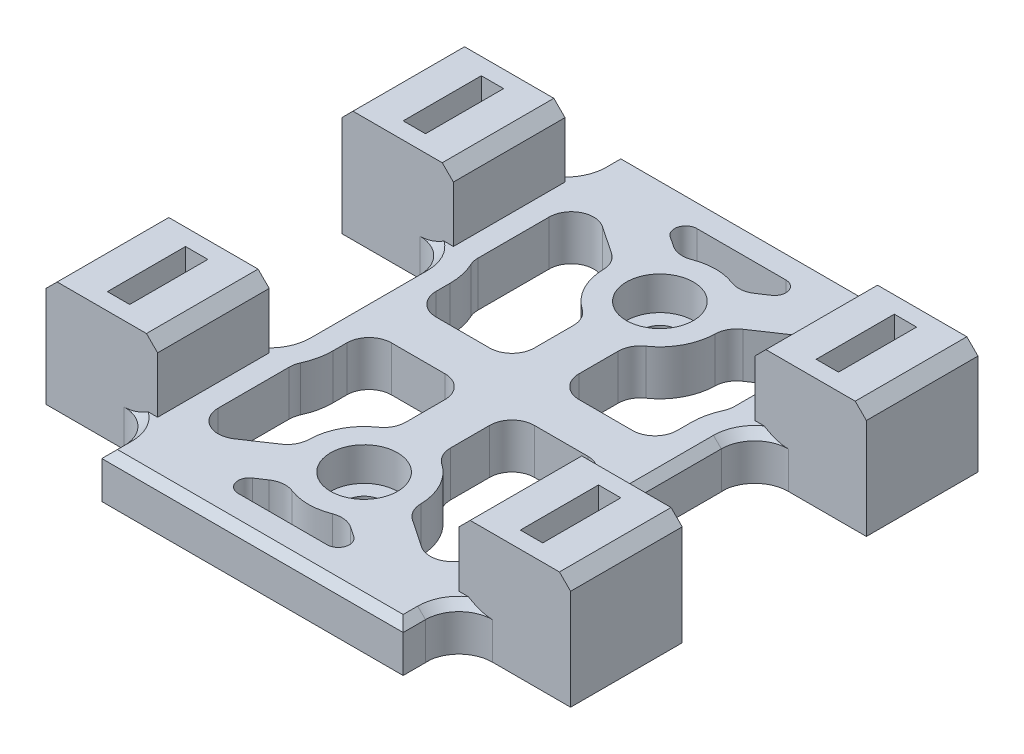
from build123d import *

# Parameters (mm, degrees)
BOSS_EXTRUDE1_DEPTH      = 4
BOSS_EXTRUDE1_DEPTH_BACK = 0.038813934
SKETCH1_W                = 27
SKETCH1_H                = 46.5
SKETCH2_W                = 10
SKETCH2_H                = 10
SKETCH2_W_2              = 7
SKETCH2_H_2              = 7
BOSS_EXTRUDE2_DEPTH      = 7
FILLET1_R                = 3
CHAMFER1_SIZE            = 0.7
SKETCH3_W                = 10
SKETCH3_H                = 10
SKETCH3_W_2              = 2
SKETCH3_H_2              = 7
BOSS_EXTRUDE3_DEPTH      = 3
CHAMFER3_SIZE            = 1
SKETCH4_R                = 3
CUT_EXTRUDE1_DEPTH       = 3
SKETCH5_R                = 1.6
CUT_EXTRUDE2_DEPTH       = 3
CUT_EXTRUDE3_DEPTH       = 35.659699043
CUT_EXTRUDE3_DEPTH_BACK  = 35.659699043


with BuildPart() as part:
    # Sketch1 → Boss-Extrude1 (new, two sides: drawn at the far end of the back side and taken through both)
    with BuildSketch(Plane(origin=(0, 0, 0), x_dir=(1, 0, 0), z_dir=(0, 1, 0)).offset(-BOSS_EXTRUDE1_DEPTH_BACK)):
        with Locations((0, -1.50974026)):
            Rectangle(SKETCH1_W, SKETCH1_H)
    extrude(amount=BOSS_EXTRUDE1_DEPTH + BOSS_EXTRUDE1_DEPTH_BACK)

    # Sketch2 → Boss-Extrude2 (add)
    # profile 1 of 4: a face of its own
    with BuildSketch(Plane(origin=(0, 0, 0), x_dir=(1, 0, 0), z_dir=(0, 1, 0))):
        with Locations((-18.5, 11.74025974)):
            Rectangle(SKETCH2_W, SKETCH2_H)
        with Locations((-18.5, 11.74025974)):
            Rectangle(SKETCH2_W_2, SKETCH2_H_2, mode=Mode.SUBTRACT)
    # profile 2 of 4: a face of its own
    with BuildSketch(Plane(origin=(0, 0, 0), x_dir=(1, 0, 0), z_dir=(0, 1, 0))):
        with Locations((18.5, -14.75974026)):
            Rectangle(SKETCH2_W, SKETCH2_H)
        with Locations((18.5, -14.75974026)):
            Rectangle(SKETCH2_W_2, SKETCH2_H_2, mode=Mode.SUBTRACT)
    # profile 3 of 4: a face of its own
    with BuildSketch(Plane(origin=(0, 0, 0), x_dir=(1, 0, 0), z_dir=(0, 1, 0))):
        with Locations((18.5, 11.74025974)):
            Rectangle(SKETCH2_W, SKETCH2_H)
        with Locations((18.5, 11.74025974)):
            Rectangle(SKETCH2_W_2, SKETCH2_H_2, mode=Mode.SUBTRACT)
    # profile 4 of 4: a face of its own
    with BuildSketch(Plane(origin=(0, 0, 0), x_dir=(1, 0, 0), z_dir=(0, 1, 0))):
        with Locations((-18.5, -14.75974026)):
            Rectangle(SKETCH2_W, SKETCH2_H)
        with Locations((-18.5, -14.75974026)):
            Rectangle(SKETCH2_W_2, SKETCH2_H_2, mode=Mode.SUBTRACT)
    extrude(amount=BOSS_EXTRUDE2_DEPTH)

    # Fillet1
    fillet1_edges = [part.edges().sort_by_distance(p)[0] for p in [
        (-13.5, 2, -6.74025974),
        (-13.5, 2, -16.74025974),
        (-13.5, 2, 19.75974026),
        (-13.5, 2, 9.75974026),
        (13.5, 2, 9.75974026),
        (13.5, 2, 19.75974026),
        (13.5, 2, -16.74025974),
        (13.5, 2, -6.74025974),
    ]]
    fillet(fillet1_edges, radius=FILLET1_R)

    # Chamfer1
    # the kernel refuses this chamfer: 0.7 mm, written as the material it takes off along each edge
    with BuildSketch(Plane(origin=(-13.5, 4, -3.74025974), x_dir=(-0.027495876610586122, -0.9996219169112968, 0), z_dir=(0, 0, 1)), Plane(origin=(13.5, 4, 6.75974026), x_dir=(0.027495876610586122, -0.9996219169112968, 0), z_dir=(0, 0, -1))) as chamfer1_piece_1:
        Polygon((CHAMFER1_SIZE * 0.999621916911, CHAMFER1_SIZE * 0.0274958766106), (-CHAMFER1_SIZE * 0.0274958766106, CHAMFER1_SIZE * 0.999621916911), (0, 0), align=None)
    extrude(amount=10.5, mode=Mode.SUBTRACT)
    with BuildSketch(Plane(origin=(-13.5, 4, 22.75974026), x_dir=(-0.027495876610586122, -0.9996219169112968, 0), z_dir=(0, 0, 1)), Plane(origin=(13.5, 4, -19.74025974), x_dir=(0.027495876610586122, -0.9996219169112968, 0), z_dir=(0, 0, -1)), Plane(origin=(13.5, 4, 26.559918351), x_dir=(0.027495876610586122, -0.9996219169112968, 0), z_dir=(0, 0, -1)), Plane(origin=(-13.5, 4, -23.540437832), x_dir=(-0.027495876610586122, -0.9996219169112968, 0), z_dir=(0, 0, 1))) as chamfer1_piece_2:
        Polygon((CHAMFER1_SIZE * 0.999621916911, CHAMFER1_SIZE * 0.0274958766106), (-CHAMFER1_SIZE * 0.0274958766106, CHAMFER1_SIZE * 0.999621916911), (0, 0), align=None)
    extrude(amount=3.800178092, mode=Mode.SUBTRACT)
    with BuildSketch(Plane(origin=(15.300178092, 4, -21.74025974), x_dir=(0, -0.9996219169112968, -0.027495876610586122), z_dir=(-1, 0, 0)), Plane(origin=(-15.300178092, 4, 24.75974026), x_dir=(0, -0.9996219169112968, 0.027495876610586122), z_dir=(1, 0, 0))) as chamfer1_piece_3:
        Polygon((CHAMFER1_SIZE * 0.999621916911, CHAMFER1_SIZE * 0.0274958766106), (-CHAMFER1_SIZE * 0.0274958766106, CHAMFER1_SIZE * 0.999621916911), (0, 0), align=None)
    extrude(amount=30.600356183, mode=Mode.SUBTRACT)
    with BuildSketch(Plane(origin=(-16.5, 4, 22.75974026), x_dir=(1, 0, 0), z_dir=(0, 0, 1))) as chamfer1_piece_4_section:
        Polygon((3, -CHAMFER1_SIZE), (3 + CHAMFER1_SIZE, 0), (3, 0), align=None)
    chamfer1_piece_4 = revolve(axis=Axis((-16.5, 4, 22.75974026), (0, 1, 0)), revolution_arc=124.394680082, mode=Mode.PRIVATE)
    chamfer1_piece_4 = split(chamfer1_piece_4, bisect_by=Plane(origin=(-14.332679869, 3.74464137, 19.75974026), z_dir=(0, 0, 1)), keep=Keep.TOP, mode=Mode.PRIVATE)
    add(chamfer1_piece_4, mode=Mode.SUBTRACT)
    with BuildSketch(Plane(origin=(-16.5, 4, -3.74025974), x_dir=(1, 0, 0), z_dir=(0, 0, 1))) as chamfer1_piece_5_section:
        Polygon((3, -CHAMFER1_SIZE), (3 + CHAMFER1_SIZE, 0), (3, 0), align=None)
    chamfer1_piece_5 = revolve(axis=Axis((-16.5, 4, -3.74025974), (0, 1, 0)), revolution_arc=124.394680082, mode=Mode.PRIVATE)
    chamfer1_piece_5 = split(chamfer1_piece_5, bisect_by=Plane(origin=(-14.332679869, 3.74464137, -6.74025974), z_dir=(0, 0, 1)), keep=Keep.TOP, mode=Mode.PRIVATE)
    add(chamfer1_piece_5, mode=Mode.SUBTRACT)
    with BuildSketch(Plane(origin=(-16.5, 4, -19.74025974), x_dir=(1, 0, 0), z_dir=(0, 0, -1))) as chamfer1_piece_6_section:
        Polygon((3, CHAMFER1_SIZE), (3 + CHAMFER1_SIZE, 0), (3, 0), align=None)
    chamfer1_piece_6 = revolve(axis=Axis((-16.5, 4, -19.74025974), (0, -1, 0)), revolution_arc=124.394680082, mode=Mode.PRIVATE)
    chamfer1_piece_6 = split(chamfer1_piece_6, bisect_by=Plane(origin=(-14.332679869, 3.74464137, -16.74025974), z_dir=(0, 0, -1)), keep=Keep.TOP, mode=Mode.PRIVATE)
    add(chamfer1_piece_6, mode=Mode.SUBTRACT)
    with BuildSketch(Plane(origin=(-16.5, 4, 6.75974026), x_dir=(1, 0, 0), z_dir=(0, 0, -1))) as chamfer1_piece_7_section:
        Polygon((3, CHAMFER1_SIZE), (3 + CHAMFER1_SIZE, 0), (3, 0), align=None)
    chamfer1_piece_7 = revolve(axis=Axis((-16.5, 4, 6.75974026), (0, -1, 0)), revolution_arc=124.394680082, mode=Mode.PRIVATE)
    chamfer1_piece_7 = split(chamfer1_piece_7, bisect_by=Plane(origin=(-14.332679869, 3.74464137, 9.75974026), z_dir=(0, 0, -1)), keep=Keep.TOP, mode=Mode.PRIVATE)
    add(chamfer1_piece_7, mode=Mode.SUBTRACT)
    with BuildSketch(Plane(origin=(16.5, 4, -19.74025974), x_dir=(-1, 0, 0), z_dir=(0, 0, -1))) as chamfer1_piece_8_section:
        Polygon((3, -CHAMFER1_SIZE), (3 + CHAMFER1_SIZE, 0), (3, 0), align=None)
    chamfer1_piece_8 = revolve(axis=Axis((16.5, 4, -19.74025974), (0, 1, 0)), revolution_arc=124.394680082, mode=Mode.PRIVATE)
    chamfer1_piece_8 = split(chamfer1_piece_8, bisect_by=Plane(origin=(14.332679869, 3.74464137, -16.74025974), z_dir=(0, 0, -1)), keep=Keep.TOP, mode=Mode.PRIVATE)
    add(chamfer1_piece_8, mode=Mode.SUBTRACT)
    with BuildSketch(Plane(origin=(16.5, 4, 6.75974026), x_dir=(-1, 0, 0), z_dir=(0, 0, -1))) as chamfer1_piece_9_section:
        Polygon((3, -CHAMFER1_SIZE), (3 + CHAMFER1_SIZE, 0), (3, 0), align=None)
    chamfer1_piece_9 = revolve(axis=Axis((16.5, 4, 6.75974026), (0, 1, 0)), revolution_arc=124.394680082, mode=Mode.PRIVATE)
    chamfer1_piece_9 = split(chamfer1_piece_9, bisect_by=Plane(origin=(14.332679869, 3.74464137, 9.75974026), z_dir=(0, 0, -1)), keep=Keep.TOP, mode=Mode.PRIVATE)
    add(chamfer1_piece_9, mode=Mode.SUBTRACT)
    with BuildSketch(Plane(origin=(16.5, 4, -3.74025974), x_dir=(-1, 0, 0), z_dir=(0, 0, 1))) as chamfer1_piece_10_section:
        Polygon((3, CHAMFER1_SIZE), (3 + CHAMFER1_SIZE, 0), (3, 0), align=None)
    chamfer1_piece_10 = revolve(axis=Axis((16.5, 4, -3.74025974), (0, -1, 0)), revolution_arc=124.394680082, mode=Mode.PRIVATE)
    chamfer1_piece_10 = split(chamfer1_piece_10, bisect_by=Plane(origin=(14.332679869, 3.74464137, -6.74025974), z_dir=(0, 0, 1)), keep=Keep.TOP, mode=Mode.PRIVATE)
    add(chamfer1_piece_10, mode=Mode.SUBTRACT)
    with BuildSketch(Plane(origin=(16.5, 4, 22.75974026), x_dir=(-1, 0, 0), z_dir=(0, 0, 1))) as chamfer1_piece_11_section:
        Polygon((3, CHAMFER1_SIZE), (3 + CHAMFER1_SIZE, 0), (3, 0), align=None)
    chamfer1_piece_11 = revolve(axis=Axis((16.5, 4, 22.75974026), (0, -1, 0)), revolution_arc=124.394680082, mode=Mode.PRIVATE)
    chamfer1_piece_11 = split(chamfer1_piece_11, bisect_by=Plane(origin=(14.332679869, 3.74464137, 19.75974026), z_dir=(0, 0, 1)), keep=Keep.TOP, mode=Mode.PRIVATE)
    add(chamfer1_piece_11, mode=Mode.SUBTRACT)

    # Sketch3 → Boss-Extrude3 (add)
    # profile 1 of 4: a face of its own
    with BuildSketch(Plane(origin=(0, 7, 0), x_dir=(1, 0, 0), z_dir=(0, 1, 0))):
        with Locations((-18.5, 11.74025974)):
            Rectangle(SKETCH3_W, SKETCH3_H)
        with Locations((-18.5, 11.74025974)):
            Rectangle(SKETCH3_W_2, SKETCH3_H_2, mode=Mode.SUBTRACT)
    # profile 2 of 4: a face of its own
    with BuildSketch(Plane(origin=(0, 7, 0), x_dir=(1, 0, 0), z_dir=(0, 1, 0))):
        with Locations((18.5, -14.75974026)):
            Rectangle(SKETCH3_W, SKETCH3_H)
        with Locations((18.5, -14.75974026)):
            Rectangle(SKETCH3_W_2, SKETCH3_H_2, mode=Mode.SUBTRACT)
    # profile 3 of 4: a face of its own
    with BuildSketch(Plane(origin=(0, 7, 0), x_dir=(1, 0, 0), z_dir=(0, 1, 0))):
        with Locations((18.5, 11.74025974)):
            Rectangle(SKETCH3_W, SKETCH3_H)
        with Locations((18.5, 11.74025974)):
            Rectangle(SKETCH3_W_2, SKETCH3_H_2, mode=Mode.SUBTRACT)
    # profile 4 of 4: a face of its own
    with BuildSketch(Plane(origin=(0, 7, 0), x_dir=(1, 0, 0), z_dir=(0, 1, 0))):
        with Locations((-18.5, -14.75974026)):
            Rectangle(SKETCH3_W, SKETCH3_H)
        with Locations((-18.5, -14.75974026)):
            Rectangle(SKETCH3_W_2, SKETCH3_H_2, mode=Mode.SUBTRACT)
    extrude(amount=BOSS_EXTRUDE3_DEPTH)

    # Chamfer3
    chamfer3_edges = [part.edges().sort_by_distance(p)[0] for p in [
        (-13.5, 10, 14.75974026),
        (-23.5, 10, 14.75974026),
        (13.5, 10, -11.74025974),
        (23.5, 10, -11.74025974),
        (23.5, 10, 14.75974026),
        (13.5, 10, 14.75974026),
        (-23.5, 10, -11.74025974),
        (-13.5, 10, -11.74025974),
    ]]
    chamfer(chamfer3_edges, length=CHAMFER3_SIZE)

    # Sketch4 → Cut-Extrude1 (cut)
    with BuildSketch(Plane(origin=(0, 4, 0), x_dir=(1, 0, 0), z_dir=(0, 1, 0))):
        with Locations(Location((0, 11.74025974, 0), (0, 0, 270))):
            Circle(SKETCH4_R)
        with Locations(Location((0, -14.75974026, 0), (0, 0, 90))):
            Circle(SKETCH4_R)
    extrude(amount=-CUT_EXTRUDE1_DEPTH, mode=Mode.SUBTRACT)

    # Sketch5 → Cut-Extrude2 (cut)
    with BuildSketch(Plane(origin=(0, 1, 0), x_dir=(1, 0, 0), z_dir=(0, 1, 0))):
        with Locations(Location((0, -14.75974026, 0), (0, 0, 270))):
            Circle(SKETCH5_R)
        with Locations(Location((0, 11.74025974, 0), (0, 0, 270))):
            Circle(SKETCH5_R)
    extrude(amount=-CUT_EXTRUDE2_DEPTH, mode=Mode.SUBTRACT)

    # Sketch6 → Cut-Extrude3 (cut, two sides: drawn at the far end of the back side and taken through both)
    with BuildSketch(Plane(origin=(0, 4, 0), x_dir=(1, 0, 0), z_dir=(0, 1, 0)).offset(-CUT_EXTRUDE3_DEPTH_BACK)):
        with BuildLine():
            Line((-2, 2.49025974), (-2, 5.995697094))
            ThreePointArc((-2, 5.995697094), (-2.227189479, 6.921517193), (-2.857142857, 7.637000707))
            ThreePointArc((-2.857142857, 7.637000707), (-4.413710723, 9.390970986), (-4.99938312, 11.661720445))
            ThreePointArc((-4.99938312, 11.661720445), (-5.241087221, 12.583857661), (-5.882201592, 13.289357682))
            Line((-5.882201592, 13.289357682), (-8.383065224, 14.973030016))
            ThreePointArc((-8.383065224, 14.973030016), (-10.439715502, 15.079461351), (-11.5, 13.313977061))
            Line((-11.5, 13.313977061), (-11.5, 6.948062727))
            ThreePointArc((-11.5, 6.948062727), (-11.454016842, 6.521661294), (-11.318181818, 6.114867146))
            ThreePointArc((-11.318181818, 6.114867146), (-10.931052001, 4.955503823), (-10.8, 3.74025974))
            Line((-10.8, 3.74025974), (-10.8, 2.49025974))
            ThreePointArc((-10.8, 2.49025974), (-10.214213562, 1.076046178), (-8.8, 0.49025974))
            Line((-8.8, 0.49025974), (-4, 0.49025974))
            ThreePointArc((-4, 0.49025974), (-2.585786438, 1.076046178), (-2, 2.49025974))
        make_face()
        with BuildLine():
            Line((10.8, 2.49025974), (10.8, 3.74025974))
            ThreePointArc((10.8, 3.74025974), (10.931052001, 4.955503823), (11.318181818, 6.114867146))
            ThreePointArc((11.318181818, 6.114867146), (11.454016842, 6.521661294), (11.5, 6.948062727))
            Line((11.5, 6.948062727), (11.5, 13.313977061))
            ThreePointArc((11.5, 13.313977061), (10.439715502, 15.079461351), (8.383065224, 14.973030016))
            Line((8.383065224, 14.973030016), (5.882201592, 13.289357682))
            ThreePointArc((5.882201592, 13.289357682), (5.241087221, 12.583857661), (4.99938312, 11.661720445))
            ThreePointArc((4.99938312, 11.661720445), (4.413710723, 9.390970986), (2.857142857, 7.637000707))
            ThreePointArc((2.857142857, 7.637000707), (2.227189479, 6.921517193), (2, 5.995697094))
            Line((2, 5.995697094), (2, 2.49025974))
            ThreePointArc((2, 2.49025974), (2.585786438, 1.076046178), (4, 0.49025974))
            Line((4, 0.49025974), (8.8, 0.49025974))
            ThreePointArc((8.8, 0.49025974), (10.214213562, 1.076046178), (10.8, 2.49025974))
        make_face()
        with BuildLine():
            Line((4, -3.50974026), (8.8, -3.50974026))
            ThreePointArc((8.8, -3.50974026), (10.214213562, -4.095526697), (10.8, -5.50974026))
            Line((10.8, -5.50974026), (10.8, -6.75974026))
            ThreePointArc((10.8, -6.75974026), (10.931052001, -7.974984343), (11.318181818, -9.134347665))
            ThreePointArc((11.318181818, -9.134347665), (11.454016842, -9.541141813), (11.5, -9.967543246))
            Line((11.5, -9.967543246), (11.5, -16.333457581))
            ThreePointArc((11.5, -16.333457581), (10.439715502, -18.09894187), (8.383065224, -17.992510535))
            Line((8.383065224, -17.992510535), (5.882201592, -16.308838201))
            ThreePointArc((5.882201592, -16.308838201), (5.241087221, -15.60333818), (4.99938312, -14.681200965))
            ThreePointArc((4.99938312, -14.681200965), (4.413710723, -12.410451506), (2.857142857, -10.656481226))
            ThreePointArc((2.857142857, -10.656481226), (2.227189479, -9.940997713), (2, -9.015177613))
            Line((2, -9.015177613), (2, -5.50974026))
            ThreePointArc((2, -5.50974026), (2.585786438, -4.095526697), (4, -3.50974026))
        make_face()
        with BuildLine():
            Line((-4, -3.50974026), (-8.8, -3.50974026))
            ThreePointArc((-8.8, -3.50974026), (-10.214213562, -4.095526697), (-10.8, -5.50974026))
            Line((-10.8, -5.50974026), (-10.8, -6.75974026))
            ThreePointArc((-10.8, -6.75974026), (-10.931052001, -7.974984343), (-11.318181818, -9.134347665))
            ThreePointArc((-11.318181818, -9.134347665), (-11.454016842, -9.541141813), (-11.5, -9.967543246))
            Line((-11.5, -9.967543246), (-11.5, -16.333457581))
            ThreePointArc((-11.5, -16.333457581), (-10.439715502, -18.09894187), (-8.383065224, -17.992510535))
            Line((-8.383065224, -17.992510535), (-5.882201592, -16.308838201))
            ThreePointArc((-5.882201592, -16.308838201), (-5.241087221, -15.60333818), (-4.99938312, -14.681200965))
            ThreePointArc((-4.99938312, -14.681200965), (-4.413710723, -12.410451506), (-2.857142857, -10.656481226))
            ThreePointArc((-2.857142857, -10.656481226), (-2.227189479, -9.940997713), (-2, -9.015177613))
            Line((-2, -9.015177613), (-2, -5.50974026))
            ThreePointArc((-2, -5.50974026), (-2.585786438, -4.095526697), (-4, -3.50974026))
        make_face()
        with BuildLine():
            Line((3.64833204, 16.607463591), (4.544406147, 17.210733263))
            ThreePointArc((4.544406147, 17.210733263), (4.942371317, 18.332213095), (3.985938759, 19.04025974))
            Line((3.985938759, 19.04025974), (-3.985938759, 19.04025974))
            ThreePointArc((-3.985938759, 19.04025974), (-4.942371317, 18.332213095), (-4.544406147, 17.210733263))
            Line((-4.544406147, 17.210733263), (-3.64833204, 16.607463591))
            ThreePointArc((-3.64833204, 16.607463591), (-2.753461839, 16.278882947), (-1.808140903, 16.401871744))
            ThreePointArc((-1.808140903, 16.401871744), (0, 16.74025974), (1.808140903, 16.401871744))
            ThreePointArc((1.808140903, 16.401871744), (2.753461839, 16.278882947), (3.64833204, 16.607463591))
        make_face()
        with BuildLine():
            Line((-4.544406147, -20.230213782), (-3.64833204, -19.626944111))
            ThreePointArc((-3.64833204, -19.626944111), (-2.753461839, -19.298363466), (-1.808140903, -19.421352264))
            ThreePointArc((-1.808140903, -19.421352264), (0, -19.75974026), (1.808140903, -19.421352264))
            ThreePointArc((1.808140903, -19.421352264), (2.753461839, -19.298363466), (3.64833204, -19.626944111))
            Line((3.64833204, -19.626944111), (4.544406147, -20.230213782))
            ThreePointArc((4.544406147, -20.230213782), (4.942371317, -21.351693614), (3.985938759, -22.05974026))
            Line((3.985938759, -22.05974026), (-3.985938759, -22.05974026))
            ThreePointArc((-3.985938759, -22.05974026), (-4.942371317, -21.351693614), (-4.544406147, -20.230213782))
        make_face()
    extrude(amount=CUT_EXTRUDE3_DEPTH + CUT_EXTRUDE3_DEPTH_BACK, mode=Mode.SUBTRACT)


solid = part.part
